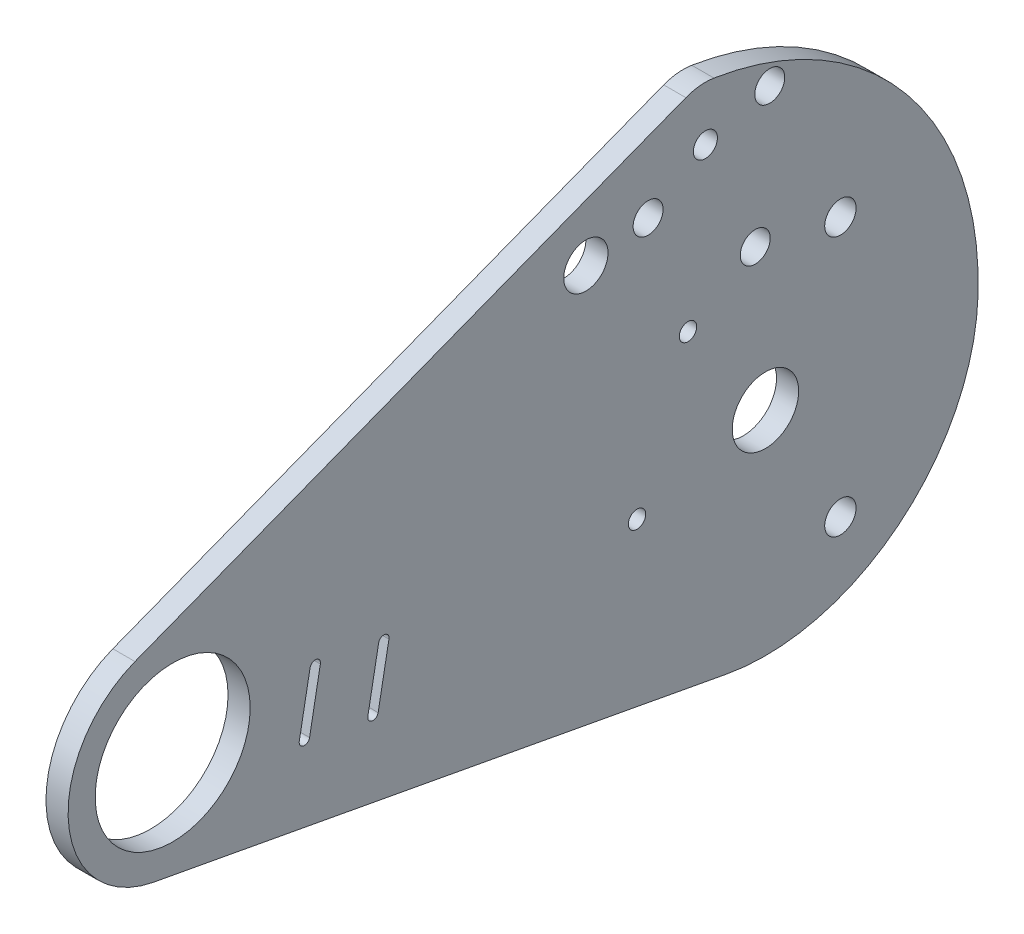
from build123d import *

# Parameters (mm, degrees)
SKETCH1_R                  = 11.1125
SKETCH1_R_2                = 4.7625
BOSS_EXTRUDE1_DEPTH        = 1.5875
M3X0_5_TAPPED_HOLE1_D      = 2.5
M4_CLEARANCE_HOLE1_D       = 4.5
F_8_32_TAPPED_HOLE1_D      = 3.4544
F_1_4_0_2500_DOWEL_HOLE1_D = 6.35
F_1_5MM_START              = -1.5875
F_1_5MM_DOWEL_SLOT1_DEPTH  = 3.175
M4_CLEARANCE_HOLE2_D       = 4.3


# Read off the part's stored shape, not the designer's step: Ø1.5mm Dowel Slot1
with BuildPart() as part:
    # Sketch1 → Boss-Extrude1 (new, symmetric)
    with BuildSketch(Plane(origin=(0, 0, 0), x_dir=(0, 0, -1), z_dir=(1, 0, 0))):
        with BuildLine():
            ThreePointArc((77.61368545, 44.94589464), (75.573628084, 45.000402813), (73.589867092, 44.521343816))
            Line((73.589867092, 44.521343816), (-5.407259882, 13.991481))
            ThreePointArc((-5.407259882, 13.991481), (-14.935591096, -1.388567103), (-2.735294118, -14.748497079))
            Line((-2.735294118, -14.748497079), (79.438235294, -29.988610727))
            ThreePointArc((79.438235294, -29.988610727), (104.085761469, -23.790412126), (115.481107121, -1.073363244))
            ThreePointArc((115.481107121, -1.073363244), (105.257248721, 29.103257737), (77.61368545, 44.94589464))
        make_face()
        Circle(SKETCH1_R, mode=Mode.SUBTRACT)
        with Locations((85, 0)):
            Circle(SKETCH1_R_2, mode=Mode.SUBTRACT)
    extrude(amount=BOSS_EXTRUDE1_DEPTH, both=True)

    # M3x0.5 Tapped Hole1 (through all)
    with Locations(Plane(origin=(1.5875, 0, 0), x_dir=(0, 0, -1), z_dir=(1, 0, 0))):
        with Locations((66.583175665, -4.32590816), (73.896496396, 15.316824335)):
            Hole(M3X0_5_TAPPED_HOLE1_D / 2)

    # M4 Clearance Hole1 (through all)
    with Locations(Plane(origin=(1.5875, 0, 0), x_dir=(0, 0, -1), z_dir=(1, 0, 0))):
        with Locations((95.75, 18.619546181), (95.75, -18.619546181)):
            Hole(M4_CLEARANCE_HOLE1_D / 2)

    # #8-32 Tapped Hole1 (through all)
    with Locations(Plane(origin=(1.5875, 0, 0), x_dir=(0, 0, -1), z_dir=(1, 0, 0))):
        with Locations((76.388124081, 37.280752399)):
            Hole(F_8_32_TAPPED_HOLE1_D / 2)

    # 1/4 (0.2500) Dowel Hole1 (through all)
    with Locations(Plane(origin=(1.5875, 0, 0), x_dir=(0, 0, -1), z_dir=(1, 0, 0))):
        with Locations((59.252323656, 30.844807364)):
            Hole(F_1_4_0_2500_DOWEL_HOLE1_D / 2)

    # Ø1.5mm Dowel Slot1 outline → Ø1.5mm Dowel Slot1 (cut)
    with BuildSketch(Plane.YZ.offset(F_1_5MM_START)):
        with BuildLine():
            Line((-1.15508269, -29.534569304), (-9.512564368, -27.984569304))
            ThreePointArc((-9.512564368, -27.984569304), (-10.386753928, -28.585229452), (-9.78609378, -29.459419012))
            Line((-9.78609378, -29.459419012), (-1.428612102, -31.009419012))
            ThreePointArc((-1.428612102, -31.009419012), (-0.554422542, -30.408758864), (-1.15508269, -29.534569304))
        make_face()
        with BuildLine():
            Line((0.668446721, -19.702237918), (-7.689034957, -18.152237918))
            ThreePointArc((-7.689034957, -18.152237918), (-8.563224517, -18.752898066), (-7.962564368, -19.627087626))
            Line((-7.962564368, -19.627087626), (0.39491731, -21.177087626))
            ThreePointArc((0.39491731, -21.177087626), (1.269106869, -20.576427477), (0.668446721, -19.702237918))
        make_face()
    extrude(amount=F_1_5MM_DOWEL_SLOT1_DEPTH, mode=Mode.SUBTRACT)

    # M4 Clearance Hole2 (through all)
    with Locations(Plane(origin=(1.5875, 0, 0), x_dir=(0, 0, -1), z_dir=(1, 0, 0))):
        with Locations((68.173492099, 32.295918862), (85.614306674, 39.965207417), (83.535698104, 21.026374654)):
            Hole(M4_CLEARANCE_HOLE2_D / 2)


solid = part.part
